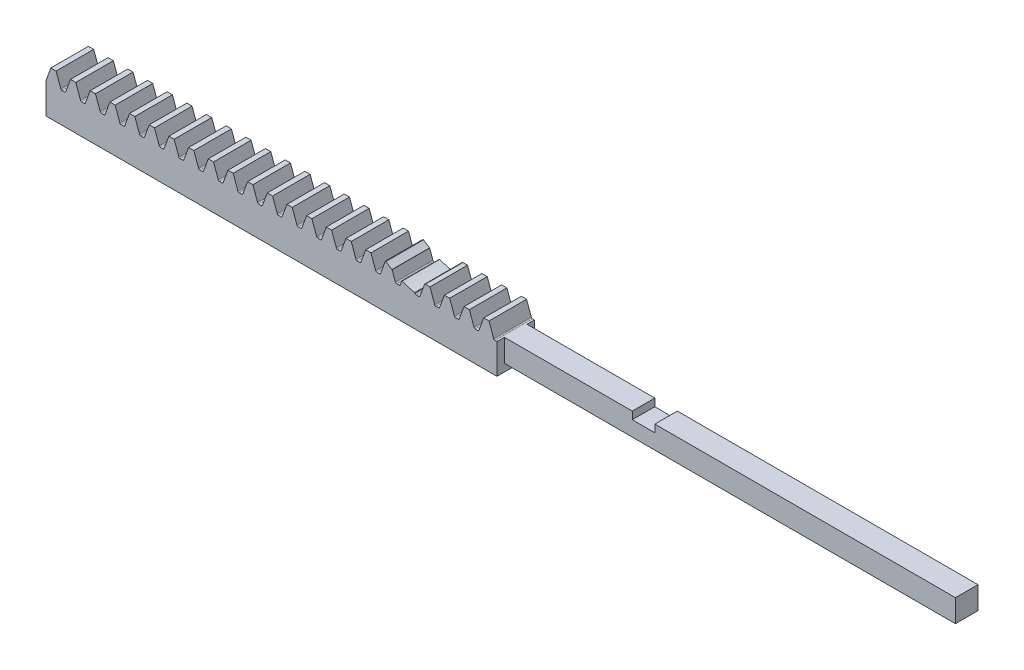
from build123d import *

# Parameters (mm, degrees)
SKETCH1_W                       = 609.6
SKETCH1_H                       = 25.4
BOSS_EXTRUDE1_DEPTH             = 12.7
CUT_EXTRUDE1_DEPTH              = 25.4
FILLET3_R                       = 0.43167355
LPATTERN4_START                 = -12.7
LPATTERN4_DEPTH                 = 25.4
SKETCH5_W                       = 609.6
SKETCH5_H                       = 25.4
CUT_EXTRUDE2_DEPTH              = 10.532533418
SKETCH6_W                       = 609.6
SKETCH6_H                       = 15.910853878
CUT_EXTRUDE3_DEPTH              = 12.7
SKETCH7_W                       = 12.7
SKETCH7_H                       = 14.867466582
CUT_EXTRUDE4_DEPTH              = 457.2
F_1_4_0_25_DIAMETER_HOLE1_D     = 6.35
F_1_4_0_25_DIAMETER_HOLE1_DEPTH = 12.7
F_1_4_0_25_DIAMETER_HOLE1_TIP   = 1.907732465
SKETCH20_W                      = 7.62
SKETCH20_H                      = 7.62
BOSS_EXTRUDE2_DEPTH             = 152.4
CUT_EXTRUDE6_DEPTH              = 12.7
CHAMFER1_SIZE                   = 0.127
CHAMFER1_SIZE2                  = 0.212490963
FILLET4_R                       = 0.127
SKETCH25_W                      = 7.62
SKETCH25_H                      = 7.62
CUT_EXTRUDE7_DEPTH              = 2.54


# Read off the part's stored shape, not the designer's step: LPattern4
with BuildPart() as part:
    # Sketch1 → Boss-Extrude1 (new, symmetric)
    with BuildSketch(Plane.XY):
        Rectangle(SKETCH1_W, SKETCH1_H)
    extrude(amount=BOSS_EXTRUDE1_DEPTH, both=True)

    # Sketch2 → Cut-Extrude1 (cut)
    with BuildSketch(Plane.XY.offset(12.7)):
        Polygon((-303.015947325, 12.7), (-301.30256958, 7.992533333), (-299.863657745, 7.992533333), (-298.15028, 12.7), align=None)
    extrude(amount=-CUT_EXTRUDE1_DEPTH, mode=Mode.SUBTRACT)

    # Fillet3
    fillet3_edges = [part.edges().sort_by_distance(p)[0] for p in [
        (-299.863657745, 7.992533333, 0),
        (-301.30256958, 7.992533333, 0),
    ]]
    fillet(fillet3_edges, radius=FILLET3_R)

    # LPattern4 outline → LPattern4 (cut)
    with BuildSketch(Plane.XY.offset(LPATTERN4_START)):
        with BuildLine():
            ThreePointArc((-294.756228955, 8.276565834), (-294.598186282, 8.070600612), (-294.350588506, 7.992533333))
            Line((-294.350588506, 7.992533333), (-293.516198819, 7.992533333))
            ThreePointArc((-293.516198819, 7.992533333), (-293.268601043, 8.070600612), (-293.11055837, 8.276565834))
            Line((-293.11055837, 8.276565834), (-291.50056, 12.7))
            Line((-291.50056, 12.7), (-296.366227325, 12.7))
            Line((-296.366227325, 12.7), (-294.756228955, 8.276565834))
        make_face()
        with BuildLine():
            Line((304.8, 12.7), (302.108572675, 12.7))
            Line((302.108572675, 12.7), (303.718571045, 8.276565834))
            ThreePointArc((303.718571045, 8.276565834), (303.876613718, 8.070600612), (304.124211494, 7.992533333))
            Line((304.124211494, 7.992533333), (304.8, 7.992533333))
            Line((304.8, 7.992533333), (304.8, 12.7))
        make_face()
        with BuildLine():
            Line((300.32452, 12.7), (295.458852675, 12.7))
            Line((295.458852675, 12.7), (297.068851045, 8.276565834))
            ThreePointArc((297.068851045, 8.276565834), (297.226893718, 8.070600612), (297.474491494, 7.992533333))
            Line((297.474491494, 7.992533333), (298.308881181, 7.992533333))
            ThreePointArc((298.308881181, 7.992533333), (298.556478957, 8.070600612), (298.71452163, 8.276565834))
            Line((298.71452163, 8.276565834), (300.32452, 12.7))
        make_face()
        with BuildLine():
            Line((293.6748, 12.7), (288.809132675, 12.7))
            Line((288.809132675, 12.7), (290.419131045, 8.276565834))
            ThreePointArc((290.419131045, 8.276565834), (290.577173718, 8.070600612), (290.824771494, 7.992533333))
            Line((290.824771494, 7.992533333), (291.659161181, 7.992533333))
            ThreePointArc((291.659161181, 7.992533333), (291.906758957, 8.070600612), (292.06480163, 8.276565834))
            Line((292.06480163, 8.276565834), (293.6748, 12.7))
        make_face()
        with BuildLine():
            Line((287.02508, 12.7), (282.159412675, 12.7))
            Line((282.159412675, 12.7), (283.769411045, 8.276565834))
            ThreePointArc((283.769411045, 8.276565834), (283.927453718, 8.070600612), (284.175051494, 7.992533333))
            Line((284.175051494, 7.992533333), (285.009441181, 7.992533333))
            ThreePointArc((285.009441181, 7.992533333), (285.257038957, 8.070600612), (285.41508163, 8.276565834))
            Line((285.41508163, 8.276565834), (287.02508, 12.7))
        make_face()
        with BuildLine():
            Line((280.37536, 12.7), (275.509692675, 12.7))
            Line((275.509692675, 12.7), (277.119691045, 8.276565834))
            ThreePointArc((277.119691045, 8.276565834), (277.277733718, 8.070600612), (277.525331494, 7.992533333))
            Line((277.525331494, 7.992533333), (278.359721181, 7.992533333))
            ThreePointArc((278.359721181, 7.992533333), (278.607318957, 8.070600612), (278.76536163, 8.276565834))
            Line((278.76536163, 8.276565834), (280.37536, 12.7))
        make_face()
        with BuildLine():
            Line((273.72564, 12.7), (268.859972675, 12.7))
            Line((268.859972675, 12.7), (270.469971045, 8.276565834))
            ThreePointArc((270.469971045, 8.276565834), (270.628013718, 8.070600612), (270.875611494, 7.992533333))
            Line((270.875611494, 7.992533333), (271.710001181, 7.992533333))
            ThreePointArc((271.710001181, 7.992533333), (271.957598957, 8.070600612), (272.11564163, 8.276565834))
            Line((272.11564163, 8.276565834), (273.72564, 12.7))
        make_face()
        with BuildLine():
            Line((267.07592, 12.7), (262.210252675, 12.7))
            Line((262.210252675, 12.7), (263.820251045, 8.276565834))
            ThreePointArc((263.820251045, 8.276565834), (263.978293718, 8.070600612), (264.225891494, 7.992533333))
            Line((264.225891494, 7.992533333), (265.060281181, 7.992533333))
            ThreePointArc((265.060281181, 7.992533333), (265.307878957, 8.070600612), (265.46592163, 8.276565834))
            Line((265.46592163, 8.276565834), (267.07592, 12.7))
        make_face()
        with BuildLine():
            Line((260.4262, 12.7), (255.560532675, 12.7))
            Line((255.560532675, 12.7), (257.170531045, 8.276565834))
            ThreePointArc((257.170531045, 8.276565834), (257.328573718, 8.070600612), (257.576171494, 7.992533333))
            Line((257.576171494, 7.992533333), (258.410561181, 7.992533333))
            ThreePointArc((258.410561181, 7.992533333), (258.658158957, 8.070600612), (258.81620163, 8.276565834))
            Line((258.81620163, 8.276565834), (260.4262, 12.7))
        make_face()
        with BuildLine():
            Line((253.77648, 12.7), (248.910812675, 12.7))
            Line((248.910812675, 12.7), (250.520811045, 8.276565834))
            ThreePointArc((250.520811045, 8.276565834), (250.678853718, 8.070600612), (250.926451494, 7.992533333))
            Line((250.926451494, 7.992533333), (251.760841181, 7.992533333))
            ThreePointArc((251.760841181, 7.992533333), (252.008438957, 8.070600612), (252.16648163, 8.276565834))
            Line((252.16648163, 8.276565834), (253.77648, 12.7))
        make_face()
        with BuildLine():
            Line((247.12676, 12.7), (242.261092675, 12.7))
            Line((242.261092675, 12.7), (243.871091045, 8.276565834))
            ThreePointArc((243.871091045, 8.276565834), (244.029133718, 8.070600612), (244.276731494, 7.992533333))
            Line((244.276731494, 7.992533333), (245.111121181, 7.992533333))
            ThreePointArc((245.111121181, 7.992533333), (245.358718957, 8.070600612), (245.51676163, 8.276565834))
            Line((245.51676163, 8.276565834), (247.12676, 12.7))
        make_face()
        with BuildLine():
            Line((240.47704, 12.7), (235.611372675, 12.7))
            Line((235.611372675, 12.7), (237.221371045, 8.276565834))
            ThreePointArc((237.221371045, 8.276565834), (237.379413718, 8.070600612), (237.627011494, 7.992533333))
            Line((237.627011494, 7.992533333), (238.461401181, 7.992533333))
            ThreePointArc((238.461401181, 7.992533333), (238.708998957, 8.070600612), (238.86704163, 8.276565834))
            Line((238.86704163, 8.276565834), (240.47704, 12.7))
        make_face()
        with BuildLine():
            Line((233.82732, 12.7), (228.961652675, 12.7))
            Line((228.961652675, 12.7), (230.571651045, 8.276565834))
            ThreePointArc((230.571651045, 8.276565834), (230.729693718, 8.070600612), (230.977291494, 7.992533333))
            Line((230.977291494, 7.992533333), (231.811681181, 7.992533333))
            ThreePointArc((231.811681181, 7.992533333), (232.059278957, 8.070600612), (232.21732163, 8.276565834))
            Line((232.21732163, 8.276565834), (233.82732, 12.7))
        make_face()
        with BuildLine():
            Line((227.1776, 12.7), (222.311932675, 12.7))
            Line((222.311932675, 12.7), (223.921931045, 8.276565834))
            ThreePointArc((223.921931045, 8.276565834), (224.079973718, 8.070600612), (224.327571494, 7.992533333))
            Line((224.327571494, 7.992533333), (225.161961181, 7.992533333))
            ThreePointArc((225.161961181, 7.992533333), (225.409558957, 8.070600612), (225.56760163, 8.276565834))
            Line((225.56760163, 8.276565834), (227.1776, 12.7))
        make_face()
        with BuildLine():
            Line((220.52788, 12.7), (215.662212675, 12.7))
            Line((215.662212675, 12.7), (217.272211045, 8.276565834))
            ThreePointArc((217.272211045, 8.276565834), (217.430253718, 8.070600612), (217.677851494, 7.992533333))
            Line((217.677851494, 7.992533333), (218.512241181, 7.992533333))
            ThreePointArc((218.512241181, 7.992533333), (218.759838957, 8.070600612), (218.91788163, 8.276565834))
            Line((218.91788163, 8.276565834), (220.52788, 12.7))
        make_face()
        with BuildLine():
            Line((213.87816, 12.7), (209.012492675, 12.7))
            Line((209.012492675, 12.7), (210.622491045, 8.276565834))
            ThreePointArc((210.622491045, 8.276565834), (210.780533718, 8.070600612), (211.028131494, 7.992533333))
            Line((211.028131494, 7.992533333), (211.862521181, 7.992533333))
            ThreePointArc((211.862521181, 7.992533333), (212.110118957, 8.070600612), (212.26816163, 8.276565834))
            Line((212.26816163, 8.276565834), (213.87816, 12.7))
        make_face()
        with BuildLine():
            Line((207.22844, 12.7), (202.362772675, 12.7))
            Line((202.362772675, 12.7), (203.972771045, 8.276565834))
            ThreePointArc((203.972771045, 8.276565834), (204.130813718, 8.070600612), (204.378411494, 7.992533333))
            Line((204.378411494, 7.992533333), (205.212801181, 7.992533333))
            ThreePointArc((205.212801181, 7.992533333), (205.460398957, 8.070600612), (205.61844163, 8.276565834))
            Line((205.61844163, 8.276565834), (207.22844, 12.7))
        make_face()
        with BuildLine():
            Line((200.57872, 12.7), (195.713052675, 12.7))
            Line((195.713052675, 12.7), (197.323051045, 8.276565834))
            ThreePointArc((197.323051045, 8.276565834), (197.481093718, 8.070600612), (197.728691494, 7.992533333))
            Line((197.728691494, 7.992533333), (198.563081181, 7.992533333))
            ThreePointArc((198.563081181, 7.992533333), (198.810678957, 8.070600612), (198.96872163, 8.276565834))
            Line((198.96872163, 8.276565834), (200.57872, 12.7))
        make_face()
        with BuildLine():
            Line((193.929, 12.7), (189.063332675, 12.7))
            Line((189.063332675, 12.7), (190.673331045, 8.276565834))
            ThreePointArc((190.673331045, 8.276565834), (190.831373718, 8.070600612), (191.078971494, 7.992533333))
            Line((191.078971494, 7.992533333), (191.913361181, 7.992533333))
            ThreePointArc((191.913361181, 7.992533333), (192.160958957, 8.070600612), (192.31900163, 8.276565834))
            Line((192.31900163, 8.276565834), (193.929, 12.7))
        make_face()
        with BuildLine():
            Line((187.27928, 12.7), (182.413612675, 12.7))
            Line((182.413612675, 12.7), (184.023611045, 8.276565834))
            ThreePointArc((184.023611045, 8.276565834), (184.181653718, 8.070600612), (184.429251494, 7.992533333))
            Line((184.429251494, 7.992533333), (185.263641181, 7.992533333))
            ThreePointArc((185.263641181, 7.992533333), (185.511238957, 8.070600612), (185.66928163, 8.276565834))
            Line((185.66928163, 8.276565834), (187.27928, 12.7))
        make_face()
        with BuildLine():
            Line((180.62956, 12.7), (175.763892675, 12.7))
            Line((175.763892675, 12.7), (177.373891045, 8.276565834))
            ThreePointArc((177.373891045, 8.276565834), (177.531933718, 8.070600612), (177.779531494, 7.992533333))
            Line((177.779531494, 7.992533333), (178.613921181, 7.992533333))
            ThreePointArc((178.613921181, 7.992533333), (178.861518957, 8.070600612), (179.01956163, 8.276565834))
            Line((179.01956163, 8.276565834), (180.62956, 12.7))
        make_face()
        with BuildLine():
            Line((173.97984, 12.7), (169.114172675, 12.7))
            Line((169.114172675, 12.7), (170.724171045, 8.276565834))
            ThreePointArc((170.724171045, 8.276565834), (170.882213718, 8.070600612), (171.129811494, 7.992533333))
            Line((171.129811494, 7.992533333), (171.964201181, 7.992533333))
            ThreePointArc((171.964201181, 7.992533333), (172.211798957, 8.070600612), (172.36984163, 8.276565834))
            Line((172.36984163, 8.276565834), (173.97984, 12.7))
        make_face()
        with BuildLine():
            Line((167.33012, 12.7), (162.464452675, 12.7))
            Line((162.464452675, 12.7), (164.074451045, 8.276565834))
            ThreePointArc((164.074451045, 8.276565834), (164.232493718, 8.070600612), (164.480091494, 7.992533333))
            Line((164.480091494, 7.992533333), (165.314481181, 7.992533333))
            ThreePointArc((165.314481181, 7.992533333), (165.562078957, 8.070600612), (165.72012163, 8.276565834))
            Line((165.72012163, 8.276565834), (167.33012, 12.7))
        make_face()
        with BuildLine():
            Line((160.6804, 12.7), (155.814732675, 12.7))
            Line((155.814732675, 12.7), (157.424731045, 8.276565834))
            ThreePointArc((157.424731045, 8.276565834), (157.582773718, 8.070600612), (157.830371494, 7.992533333))
            Line((157.830371494, 7.992533333), (158.664761181, 7.992533333))
            ThreePointArc((158.664761181, 7.992533333), (158.912358957, 8.070600612), (159.07040163, 8.276565834))
            Line((159.07040163, 8.276565834), (160.6804, 12.7))
        make_face()
        with BuildLine():
            Line((154.03068, 12.7), (149.165012675, 12.7))
            Line((149.165012675, 12.7), (150.775011045, 8.276565834))
            ThreePointArc((150.775011045, 8.276565834), (150.933053718, 8.070600612), (151.180651494, 7.992533333))
            Line((151.180651494, 7.992533333), (152.015041181, 7.992533333))
            ThreePointArc((152.015041181, 7.992533333), (152.262638957, 8.070600612), (152.42068163, 8.276565834))
            Line((152.42068163, 8.276565834), (154.03068, 12.7))
        make_face()
        with BuildLine():
            Line((147.38096, 12.7), (142.515292675, 12.7))
            Line((142.515292675, 12.7), (144.125291045, 8.276565834))
            ThreePointArc((144.125291045, 8.276565834), (144.283333718, 8.070600612), (144.530931494, 7.992533333))
            Line((144.530931494, 7.992533333), (145.365321181, 7.992533333))
            ThreePointArc((145.365321181, 7.992533333), (145.612918957, 8.070600612), (145.77096163, 8.276565834))
            Line((145.77096163, 8.276565834), (147.38096, 12.7))
        make_face()
        with BuildLine():
            Line((140.73124, 12.7), (135.865572675, 12.7))
            Line((135.865572675, 12.7), (137.475571045, 8.276565834))
            ThreePointArc((137.475571045, 8.276565834), (137.633613718, 8.070600612), (137.881211494, 7.992533333))
            Line((137.881211494, 7.992533333), (138.715601181, 7.992533333))
            ThreePointArc((138.715601181, 7.992533333), (138.963198957, 8.070600612), (139.12124163, 8.276565834))
            Line((139.12124163, 8.276565834), (140.73124, 12.7))
        make_face()
        with BuildLine():
            Line((134.08152, 12.7), (129.215852675, 12.7))
            Line((129.215852675, 12.7), (130.825851045, 8.276565834))
            ThreePointArc((130.825851045, 8.276565834), (130.983893718, 8.070600612), (131.231491494, 7.992533333))
            Line((131.231491494, 7.992533333), (132.065881181, 7.992533333))
            ThreePointArc((132.065881181, 7.992533333), (132.313478957, 8.070600612), (132.47152163, 8.276565834))
            Line((132.47152163, 8.276565834), (134.08152, 12.7))
        make_face()
        with BuildLine():
            Line((127.4318, 12.7), (122.566132675, 12.7))
            Line((122.566132675, 12.7), (124.176131045, 8.276565834))
            ThreePointArc((124.176131045, 8.276565834), (124.334173718, 8.070600612), (124.581771494, 7.992533333))
            Line((124.581771494, 7.992533333), (125.416161181, 7.992533333))
            ThreePointArc((125.416161181, 7.992533333), (125.663758957, 8.070600612), (125.82180163, 8.276565834))
            Line((125.82180163, 8.276565834), (127.4318, 12.7))
        make_face()
        with BuildLine():
            Line((120.78208, 12.7), (115.916412675, 12.7))
            Line((115.916412675, 12.7), (117.526411045, 8.276565834))
            ThreePointArc((117.526411045, 8.276565834), (117.684453718, 8.070600612), (117.932051494, 7.992533333))
            Line((117.932051494, 7.992533333), (118.766441181, 7.992533333))
            ThreePointArc((118.766441181, 7.992533333), (119.014038957, 8.070600612), (119.17208163, 8.276565834))
            Line((119.17208163, 8.276565834), (120.78208, 12.7))
        make_face()
        with BuildLine():
            Line((114.13236, 12.7), (109.266692675, 12.7))
            Line((109.266692675, 12.7), (110.876691045, 8.276565834))
            ThreePointArc((110.876691045, 8.276565834), (111.034733718, 8.070600612), (111.282331494, 7.992533333))
            Line((111.282331494, 7.992533333), (112.116721181, 7.992533333))
            ThreePointArc((112.116721181, 7.992533333), (112.364318957, 8.070600612), (112.52236163, 8.276565834))
            Line((112.52236163, 8.276565834), (114.13236, 12.7))
        make_face()
        with BuildLine():
            Line((107.48264, 12.7), (102.616972675, 12.7))
            Line((102.616972675, 12.7), (104.226971045, 8.276565834))
            ThreePointArc((104.226971045, 8.276565834), (104.385013718, 8.070600612), (104.632611494, 7.992533333))
            Line((104.632611494, 7.992533333), (105.467001181, 7.992533333))
            ThreePointArc((105.467001181, 7.992533333), (105.714598957, 8.070600612), (105.87264163, 8.276565834))
            Line((105.87264163, 8.276565834), (107.48264, 12.7))
        make_face()
        with BuildLine():
            Line((100.83292, 12.7), (95.967252675, 12.7))
            Line((95.967252675, 12.7), (97.577251045, 8.276565834))
            ThreePointArc((97.577251045, 8.276565834), (97.735293718, 8.070600612), (97.982891494, 7.992533333))
            Line((97.982891494, 7.992533333), (98.817281181, 7.992533333))
            ThreePointArc((98.817281181, 7.992533333), (99.064878957, 8.070600612), (99.22292163, 8.276565834))
            Line((99.22292163, 8.276565834), (100.83292, 12.7))
        make_face()
        with BuildLine():
            Line((94.1832, 12.7), (89.317532675, 12.7))
            Line((89.317532675, 12.7), (90.927531045, 8.276565834))
            ThreePointArc((90.927531045, 8.276565834), (91.085573718, 8.070600612), (91.333171494, 7.992533333))
            Line((91.333171494, 7.992533333), (92.167561181, 7.992533333))
            ThreePointArc((92.167561181, 7.992533333), (92.415158957, 8.070600612), (92.57320163, 8.276565834))
            Line((92.57320163, 8.276565834), (94.1832, 12.7))
        make_face()
        with BuildLine():
            Line((87.53348, 12.7), (82.667812675, 12.7))
            Line((82.667812675, 12.7), (84.277811045, 8.276565834))
            ThreePointArc((84.277811045, 8.276565834), (84.435853718, 8.070600612), (84.683451494, 7.992533333))
            Line((84.683451494, 7.992533333), (85.517841181, 7.992533333))
            ThreePointArc((85.517841181, 7.992533333), (85.765438957, 8.070600612), (85.92348163, 8.276565834))
            Line((85.92348163, 8.276565834), (87.53348, 12.7))
        make_face()
        with BuildLine():
            Line((80.88376, 12.7), (76.018092675, 12.7))
            Line((76.018092675, 12.7), (77.628091045, 8.276565834))
            ThreePointArc((77.628091045, 8.276565834), (77.786133718, 8.070600612), (78.033731494, 7.992533333))
            Line((78.033731494, 7.992533333), (78.868121181, 7.992533333))
            ThreePointArc((78.868121181, 7.992533333), (79.115718957, 8.070600612), (79.27376163, 8.276565834))
            Line((79.27376163, 8.276565834), (80.88376, 12.7))
        make_face()
        with BuildLine():
            Line((74.23404, 12.7), (69.368372675, 12.7))
            Line((69.368372675, 12.7), (70.978371045, 8.276565834))
            ThreePointArc((70.978371045, 8.276565834), (71.136413718, 8.070600612), (71.384011494, 7.992533333))
            Line((71.384011494, 7.992533333), (72.218401181, 7.992533333))
            ThreePointArc((72.218401181, 7.992533333), (72.465998957, 8.070600612), (72.62404163, 8.276565834))
            Line((72.62404163, 8.276565834), (74.23404, 12.7))
        make_face()
        with BuildLine():
            Line((67.58432, 12.7), (62.718652675, 12.7))
            Line((62.718652675, 12.7), (64.328651045, 8.276565834))
            ThreePointArc((64.328651045, 8.276565834), (64.486693718, 8.070600612), (64.734291494, 7.992533333))
            Line((64.734291494, 7.992533333), (65.568681181, 7.992533333))
            ThreePointArc((65.568681181, 7.992533333), (65.816278957, 8.070600612), (65.97432163, 8.276565834))
            Line((65.97432163, 8.276565834), (67.58432, 12.7))
        make_face()
        with BuildLine():
            Line((60.9346, 12.7), (56.068932675, 12.7))
            Line((56.068932675, 12.7), (57.678931045, 8.276565834))
            ThreePointArc((57.678931045, 8.276565834), (57.836973718, 8.070600612), (58.084571494, 7.992533333))
            Line((58.084571494, 7.992533333), (58.918961181, 7.992533333))
            ThreePointArc((58.918961181, 7.992533333), (59.166558957, 8.070600612), (59.32460163, 8.276565834))
            Line((59.32460163, 8.276565834), (60.9346, 12.7))
        make_face()
        with BuildLine():
            Line((54.28488, 12.7), (49.419212675, 12.7))
            Line((49.419212675, 12.7), (51.029211045, 8.276565834))
            ThreePointArc((51.029211045, 8.276565834), (51.187253718, 8.070600612), (51.434851494, 7.992533333))
            Line((51.434851494, 7.992533333), (52.269241181, 7.992533333))
            ThreePointArc((52.269241181, 7.992533333), (52.516838957, 8.070600612), (52.67488163, 8.276565834))
            Line((52.67488163, 8.276565834), (54.28488, 12.7))
        make_face()
        with BuildLine():
            Line((47.63516, 12.7), (42.769492675, 12.7))
            Line((42.769492675, 12.7), (44.379491045, 8.276565834))
            ThreePointArc((44.379491045, 8.276565834), (44.537533718, 8.070600612), (44.785131494, 7.992533333))
            Line((44.785131494, 7.992533333), (45.619521181, 7.992533333))
            ThreePointArc((45.619521181, 7.992533333), (45.867118957, 8.070600612), (46.02516163, 8.276565834))
            Line((46.02516163, 8.276565834), (47.63516, 12.7))
        make_face()
        with BuildLine():
            Line((40.98544, 12.7), (36.119772675, 12.7))
            Line((36.119772675, 12.7), (37.729771045, 8.276565834))
            ThreePointArc((37.729771045, 8.276565834), (37.887813718, 8.070600612), (38.135411494, 7.992533333))
            Line((38.135411494, 7.992533333), (38.969801181, 7.992533333))
            ThreePointArc((38.969801181, 7.992533333), (39.217398957, 8.070600612), (39.37544163, 8.276565834))
            Line((39.37544163, 8.276565834), (40.98544, 12.7))
        make_face()
        with BuildLine():
            Line((34.33572, 12.7), (29.470052675, 12.7))
            Line((29.470052675, 12.7), (31.080051045, 8.276565834))
            ThreePointArc((31.080051045, 8.276565834), (31.238093718, 8.070600612), (31.485691494, 7.992533333))
            Line((31.485691494, 7.992533333), (32.320081181, 7.992533333))
            ThreePointArc((32.320081181, 7.992533333), (32.567678957, 8.070600612), (32.72572163, 8.276565834))
            Line((32.72572163, 8.276565834), (34.33572, 12.7))
        make_face()
        with BuildLine():
            Line((27.686, 12.7), (22.820332675, 12.7))
            Line((22.820332675, 12.7), (24.430331045, 8.276565834))
            ThreePointArc((24.430331045, 8.276565834), (24.588373718, 8.070600612), (24.835971494, 7.992533333))
            Line((24.835971494, 7.992533333), (25.670361181, 7.992533333))
            ThreePointArc((25.670361181, 7.992533333), (25.917958957, 8.070600612), (26.07600163, 8.276565834))
            Line((26.07600163, 8.276565834), (27.686, 12.7))
        make_face()
        with BuildLine():
            Line((21.03628, 12.7), (16.170612675, 12.7))
            Line((16.170612675, 12.7), (17.780611045, 8.276565834))
            ThreePointArc((17.780611045, 8.276565834), (17.938653718, 8.070600612), (18.186251494, 7.992533333))
            Line((18.186251494, 7.992533333), (19.020641181, 7.992533333))
            ThreePointArc((19.020641181, 7.992533333), (19.268238957, 8.070600612), (19.42628163, 8.276565834))
            Line((19.42628163, 8.276565834), (21.03628, 12.7))
        make_face()
        with BuildLine():
            Line((14.38656, 12.7), (9.520892675, 12.7))
            Line((9.520892675, 12.7), (11.130891045, 8.276565834))
            ThreePointArc((11.130891045, 8.276565834), (11.288933718, 8.070600612), (11.536531494, 7.992533333))
            Line((11.536531494, 7.992533333), (12.370921181, 7.992533333))
            ThreePointArc((12.370921181, 7.992533333), (12.618518957, 8.070600612), (12.77656163, 8.276565834))
            Line((12.77656163, 8.276565834), (14.38656, 12.7))
        make_face()
        with BuildLine():
            Line((7.73684, 12.7), (2.871172675, 12.7))
            Line((2.871172675, 12.7), (4.481171045, 8.276565834))
            ThreePointArc((4.481171045, 8.276565834), (4.639213718, 8.070600612), (4.886811494, 7.992533333))
            Line((4.886811494, 7.992533333), (5.721201181, 7.992533333))
            ThreePointArc((5.721201181, 7.992533333), (5.968798957, 8.070600612), (6.12684163, 8.276565834))
            Line((6.12684163, 8.276565834), (7.73684, 12.7))
        make_face()
        with BuildLine():
            Line((1.08712, 12.7), (-3.778547325, 12.7))
            Line((-3.778547325, 12.7), (-2.168548955, 8.276565834))
            ThreePointArc((-2.168548955, 8.276565834), (-2.010506282, 8.070600612), (-1.762908506, 7.992533333))
            Line((-1.762908506, 7.992533333), (-0.928518819, 7.992533333))
            ThreePointArc((-0.928518819, 7.992533333), (-0.680921043, 8.070600612), (-0.52287837, 8.276565834))
            Line((-0.52287837, 8.276565834), (1.08712, 12.7))
        make_face()
        with BuildLine():
            Line((-5.5626, 12.7), (-10.428267325, 12.7))
            Line((-10.428267325, 12.7), (-8.818268955, 8.276565834))
            ThreePointArc((-8.818268955, 8.276565834), (-8.660226282, 8.070600612), (-8.412628506, 7.992533333))
            Line((-8.412628506, 7.992533333), (-7.578238819, 7.992533333))
            ThreePointArc((-7.578238819, 7.992533333), (-7.330641043, 8.070600612), (-7.17259837, 8.276565834))
            Line((-7.17259837, 8.276565834), (-5.5626, 12.7))
        make_face()
        with BuildLine():
            Line((-12.21232, 12.7), (-17.077987325, 12.7))
            Line((-17.077987325, 12.7), (-15.467988955, 8.276565834))
            ThreePointArc((-15.467988955, 8.276565834), (-15.309946282, 8.070600612), (-15.062348506, 7.992533333))
            Line((-15.062348506, 7.992533333), (-14.227958819, 7.992533333))
            ThreePointArc((-14.227958819, 7.992533333), (-13.980361043, 8.070600612), (-13.82231837, 8.276565834))
            Line((-13.82231837, 8.276565834), (-12.21232, 12.7))
        make_face()
        with BuildLine():
            Line((-18.86204, 12.7), (-23.727707325, 12.7))
            Line((-23.727707325, 12.7), (-22.117708955, 8.276565834))
            ThreePointArc((-22.117708955, 8.276565834), (-21.959666282, 8.070600612), (-21.712068506, 7.992533333))
            Line((-21.712068506, 7.992533333), (-20.877678819, 7.992533333))
            ThreePointArc((-20.877678819, 7.992533333), (-20.630081043, 8.070600612), (-20.47203837, 8.276565834))
            Line((-20.47203837, 8.276565834), (-18.86204, 12.7))
        make_face()
        with BuildLine():
            Line((-25.51176, 12.7), (-30.377427325, 12.7))
            Line((-30.377427325, 12.7), (-28.767428955, 8.276565834))
            ThreePointArc((-28.767428955, 8.276565834), (-28.609386282, 8.070600612), (-28.361788506, 7.992533333))
            Line((-28.361788506, 7.992533333), (-27.527398819, 7.992533333))
            ThreePointArc((-27.527398819, 7.992533333), (-27.279801043, 8.070600612), (-27.12175837, 8.276565834))
            Line((-27.12175837, 8.276565834), (-25.51176, 12.7))
        make_face()
        with BuildLine():
            Line((-32.16148, 12.7), (-37.027147325, 12.7))
            Line((-37.027147325, 12.7), (-35.417148955, 8.276565834))
            ThreePointArc((-35.417148955, 8.276565834), (-35.259106282, 8.070600612), (-35.011508506, 7.992533333))
            Line((-35.011508506, 7.992533333), (-34.177118819, 7.992533333))
            ThreePointArc((-34.177118819, 7.992533333), (-33.929521043, 8.070600612), (-33.77147837, 8.276565834))
            Line((-33.77147837, 8.276565834), (-32.16148, 12.7))
        make_face()
        with BuildLine():
            Line((-38.8112, 12.7), (-43.676867325, 12.7))
            Line((-43.676867325, 12.7), (-42.066868955, 8.276565834))
            ThreePointArc((-42.066868955, 8.276565834), (-41.908826282, 8.070600612), (-41.661228506, 7.992533333))
            Line((-41.661228506, 7.992533333), (-40.826838819, 7.992533333))
            ThreePointArc((-40.826838819, 7.992533333), (-40.579241043, 8.070600612), (-40.42119837, 8.276565834))
            Line((-40.42119837, 8.276565834), (-38.8112, 12.7))
        make_face()
        with BuildLine():
            Line((-45.46092, 12.7), (-50.326587325, 12.7))
            Line((-50.326587325, 12.7), (-48.716588955, 8.276565834))
            ThreePointArc((-48.716588955, 8.276565834), (-48.558546282, 8.070600612), (-48.310948506, 7.992533333))
            Line((-48.310948506, 7.992533333), (-47.476558819, 7.992533333))
            ThreePointArc((-47.476558819, 7.992533333), (-47.228961043, 8.070600612), (-47.07091837, 8.276565834))
            Line((-47.07091837, 8.276565834), (-45.46092, 12.7))
        make_face()
        with BuildLine():
            Line((-52.11064, 12.7), (-56.976307325, 12.7))
            Line((-56.976307325, 12.7), (-55.366308955, 8.276565834))
            ThreePointArc((-55.366308955, 8.276565834), (-55.208266282, 8.070600612), (-54.960668506, 7.992533333))
            Line((-54.960668506, 7.992533333), (-54.126278819, 7.992533333))
            ThreePointArc((-54.126278819, 7.992533333), (-53.878681043, 8.070600612), (-53.72063837, 8.276565834))
            Line((-53.72063837, 8.276565834), (-52.11064, 12.7))
        make_face()
        with BuildLine():
            Line((-58.76036, 12.7), (-63.626027325, 12.7))
            Line((-63.626027325, 12.7), (-62.016028955, 8.276565834))
            ThreePointArc((-62.016028955, 8.276565834), (-61.857986282, 8.070600612), (-61.610388506, 7.992533333))
            Line((-61.610388506, 7.992533333), (-60.775998819, 7.992533333))
            ThreePointArc((-60.775998819, 7.992533333), (-60.528401043, 8.070600612), (-60.37035837, 8.276565834))
            Line((-60.37035837, 8.276565834), (-58.76036, 12.7))
        make_face()
        with BuildLine():
            Line((-65.41008, 12.7), (-70.275747325, 12.7))
            Line((-70.275747325, 12.7), (-68.665748955, 8.276565834))
            ThreePointArc((-68.665748955, 8.276565834), (-68.507706282, 8.070600612), (-68.260108506, 7.992533333))
            Line((-68.260108506, 7.992533333), (-67.425718819, 7.992533333))
            ThreePointArc((-67.425718819, 7.992533333), (-67.178121043, 8.070600612), (-67.02007837, 8.276565834))
            Line((-67.02007837, 8.276565834), (-65.41008, 12.7))
        make_face()
        with BuildLine():
            Line((-72.0598, 12.7), (-76.925467325, 12.7))
            Line((-76.925467325, 12.7), (-75.315468955, 8.276565834))
            ThreePointArc((-75.315468955, 8.276565834), (-75.157426282, 8.070600612), (-74.909828506, 7.992533333))
            Line((-74.909828506, 7.992533333), (-74.075438819, 7.992533333))
            ThreePointArc((-74.075438819, 7.992533333), (-73.827841043, 8.070600612), (-73.66979837, 8.276565834))
            Line((-73.66979837, 8.276565834), (-72.0598, 12.7))
        make_face()
        with BuildLine():
            Line((-78.70952, 12.7), (-83.575187325, 12.7))
            Line((-83.575187325, 12.7), (-81.965188955, 8.276565834))
            ThreePointArc((-81.965188955, 8.276565834), (-81.807146282, 8.070600612), (-81.559548506, 7.992533333))
            Line((-81.559548506, 7.992533333), (-80.725158819, 7.992533333))
            ThreePointArc((-80.725158819, 7.992533333), (-80.477561043, 8.070600612), (-80.31951837, 8.276565834))
            Line((-80.31951837, 8.276565834), (-78.70952, 12.7))
        make_face()
        with BuildLine():
            Line((-85.35924, 12.7), (-90.224907325, 12.7))
            Line((-90.224907325, 12.7), (-88.614908955, 8.276565834))
            ThreePointArc((-88.614908955, 8.276565834), (-88.456866282, 8.070600612), (-88.209268506, 7.992533333))
            Line((-88.209268506, 7.992533333), (-87.374878819, 7.992533333))
            ThreePointArc((-87.374878819, 7.992533333), (-87.127281043, 8.070600612), (-86.96923837, 8.276565834))
            Line((-86.96923837, 8.276565834), (-85.35924, 12.7))
        make_face()
        with BuildLine():
            Line((-92.00896, 12.7), (-96.874627325, 12.7))
            Line((-96.874627325, 12.7), (-95.264628955, 8.276565834))
            ThreePointArc((-95.264628955, 8.276565834), (-95.106586282, 8.070600612), (-94.858988506, 7.992533333))
            Line((-94.858988506, 7.992533333), (-94.024598819, 7.992533333))
            ThreePointArc((-94.024598819, 7.992533333), (-93.777001043, 8.070600612), (-93.61895837, 8.276565834))
            Line((-93.61895837, 8.276565834), (-92.00896, 12.7))
        make_face()
        with BuildLine():
            Line((-98.65868, 12.7), (-103.524347325, 12.7))
            Line((-103.524347325, 12.7), (-101.914348955, 8.276565834))
            ThreePointArc((-101.914348955, 8.276565834), (-101.756306282, 8.070600612), (-101.508708506, 7.992533333))
            Line((-101.508708506, 7.992533333), (-100.674318819, 7.992533333))
            ThreePointArc((-100.674318819, 7.992533333), (-100.426721043, 8.070600612), (-100.26867837, 8.276565834))
            Line((-100.26867837, 8.276565834), (-98.65868, 12.7))
        make_face()
        with BuildLine():
            Line((-105.3084, 12.7), (-110.174067325, 12.7))
            Line((-110.174067325, 12.7), (-108.564068955, 8.276565834))
            ThreePointArc((-108.564068955, 8.276565834), (-108.406026282, 8.070600612), (-108.158428506, 7.992533333))
            Line((-108.158428506, 7.992533333), (-107.324038819, 7.992533333))
            ThreePointArc((-107.324038819, 7.992533333), (-107.076441043, 8.070600612), (-106.91839837, 8.276565834))
            Line((-106.91839837, 8.276565834), (-105.3084, 12.7))
        make_face()
        with BuildLine():
            Line((-111.95812, 12.7), (-116.823787325, 12.7))
            Line((-116.823787325, 12.7), (-115.213788955, 8.276565834))
            ThreePointArc((-115.213788955, 8.276565834), (-115.055746282, 8.070600612), (-114.808148506, 7.992533333))
            Line((-114.808148506, 7.992533333), (-113.973758819, 7.992533333))
            ThreePointArc((-113.973758819, 7.992533333), (-113.726161043, 8.070600612), (-113.56811837, 8.276565834))
            Line((-113.56811837, 8.276565834), (-111.95812, 12.7))
        make_face()
        with BuildLine():
            Line((-118.60784, 12.7), (-123.473507325, 12.7))
            Line((-123.473507325, 12.7), (-121.863508955, 8.276565834))
            ThreePointArc((-121.863508955, 8.276565834), (-121.705466282, 8.070600612), (-121.457868506, 7.992533333))
            Line((-121.457868506, 7.992533333), (-120.623478819, 7.992533333))
            ThreePointArc((-120.623478819, 7.992533333), (-120.375881043, 8.070600612), (-120.21783837, 8.276565834))
            Line((-120.21783837, 8.276565834), (-118.60784, 12.7))
        make_face()
        with BuildLine():
            Line((-125.25756, 12.7), (-130.123227325, 12.7))
            Line((-130.123227325, 12.7), (-128.513228955, 8.276565834))
            ThreePointArc((-128.513228955, 8.276565834), (-128.355186282, 8.070600612), (-128.107588506, 7.992533333))
            Line((-128.107588506, 7.992533333), (-127.273198819, 7.992533333))
            ThreePointArc((-127.273198819, 7.992533333), (-127.025601043, 8.070600612), (-126.86755837, 8.276565834))
            Line((-126.86755837, 8.276565834), (-125.25756, 12.7))
        make_face()
        with BuildLine():
            Line((-131.90728, 12.7), (-136.772947325, 12.7))
            Line((-136.772947325, 12.7), (-135.162948955, 8.276565834))
            ThreePointArc((-135.162948955, 8.276565834), (-135.004906282, 8.070600612), (-134.757308506, 7.992533333))
            Line((-134.757308506, 7.992533333), (-133.922918819, 7.992533333))
            ThreePointArc((-133.922918819, 7.992533333), (-133.675321043, 8.070600612), (-133.51727837, 8.276565834))
            Line((-133.51727837, 8.276565834), (-131.90728, 12.7))
        make_face()
        with BuildLine():
            Line((-138.557, 12.7), (-143.422667325, 12.7))
            Line((-143.422667325, 12.7), (-141.812668955, 8.276565834))
            ThreePointArc((-141.812668955, 8.276565834), (-141.654626282, 8.070600612), (-141.407028506, 7.992533333))
            Line((-141.407028506, 7.992533333), (-140.572638819, 7.992533333))
            ThreePointArc((-140.572638819, 7.992533333), (-140.325041043, 8.070600612), (-140.16699837, 8.276565834))
            Line((-140.16699837, 8.276565834), (-138.557, 12.7))
        make_face()
        with BuildLine():
            Line((-145.20672, 12.7), (-150.072387325, 12.7))
            Line((-150.072387325, 12.7), (-148.462388955, 8.276565834))
            ThreePointArc((-148.462388955, 8.276565834), (-148.304346282, 8.070600612), (-148.056748506, 7.992533333))
            Line((-148.056748506, 7.992533333), (-147.222358819, 7.992533333))
            ThreePointArc((-147.222358819, 7.992533333), (-146.974761043, 8.070600612), (-146.81671837, 8.276565834))
            Line((-146.81671837, 8.276565834), (-145.20672, 12.7))
        make_face()
        with BuildLine():
            Line((-151.85644, 12.7), (-156.722107325, 12.7))
            Line((-156.722107325, 12.7), (-155.112108955, 8.276565834))
            ThreePointArc((-155.112108955, 8.276565834), (-154.954066282, 8.070600612), (-154.706468506, 7.992533333))
            Line((-154.706468506, 7.992533333), (-153.872078819, 7.992533333))
            ThreePointArc((-153.872078819, 7.992533333), (-153.624481043, 8.070600612), (-153.46643837, 8.276565834))
            Line((-153.46643837, 8.276565834), (-151.85644, 12.7))
        make_face()
        with BuildLine():
            Line((-158.50616, 12.7), (-163.371827325, 12.7))
            Line((-163.371827325, 12.7), (-161.761828955, 8.276565834))
            ThreePointArc((-161.761828955, 8.276565834), (-161.603786282, 8.070600612), (-161.356188506, 7.992533333))
            Line((-161.356188506, 7.992533333), (-160.521798819, 7.992533333))
            ThreePointArc((-160.521798819, 7.992533333), (-160.274201043, 8.070600612), (-160.11615837, 8.276565834))
            Line((-160.11615837, 8.276565834), (-158.50616, 12.7))
        make_face()
        with BuildLine():
            Line((-165.15588, 12.7), (-170.021547325, 12.7))
            Line((-170.021547325, 12.7), (-168.411548955, 8.276565834))
            ThreePointArc((-168.411548955, 8.276565834), (-168.253506282, 8.070600612), (-168.005908506, 7.992533333))
            Line((-168.005908506, 7.992533333), (-167.171518819, 7.992533333))
            ThreePointArc((-167.171518819, 7.992533333), (-166.923921043, 8.070600612), (-166.76587837, 8.276565834))
            Line((-166.76587837, 8.276565834), (-165.15588, 12.7))
        make_face()
        with BuildLine():
            Line((-171.8056, 12.7), (-176.671267325, 12.7))
            Line((-176.671267325, 12.7), (-175.061268955, 8.276565834))
            ThreePointArc((-175.061268955, 8.276565834), (-174.903226282, 8.070600612), (-174.655628506, 7.992533333))
            Line((-174.655628506, 7.992533333), (-173.821238819, 7.992533333))
            ThreePointArc((-173.821238819, 7.992533333), (-173.573641043, 8.070600612), (-173.41559837, 8.276565834))
            Line((-173.41559837, 8.276565834), (-171.8056, 12.7))
        make_face()
        with BuildLine():
            Line((-178.45532, 12.7), (-183.320987325, 12.7))
            Line((-183.320987325, 12.7), (-181.710988955, 8.276565834))
            ThreePointArc((-181.710988955, 8.276565834), (-181.552946282, 8.070600612), (-181.305348506, 7.992533333))
            Line((-181.305348506, 7.992533333), (-180.470958819, 7.992533333))
            ThreePointArc((-180.470958819, 7.992533333), (-180.223361043, 8.070600612), (-180.06531837, 8.276565834))
            Line((-180.06531837, 8.276565834), (-178.45532, 12.7))
        make_face()
        with BuildLine():
            Line((-185.10504, 12.7), (-189.970707325, 12.7))
            Line((-189.970707325, 12.7), (-188.360708955, 8.276565834))
            ThreePointArc((-188.360708955, 8.276565834), (-188.202666282, 8.070600612), (-187.955068506, 7.992533333))
            Line((-187.955068506, 7.992533333), (-187.120678819, 7.992533333))
            ThreePointArc((-187.120678819, 7.992533333), (-186.873081043, 8.070600612), (-186.71503837, 8.276565834))
            Line((-186.71503837, 8.276565834), (-185.10504, 12.7))
        make_face()
        with BuildLine():
            Line((-191.75476, 12.7), (-196.620427325, 12.7))
            Line((-196.620427325, 12.7), (-195.010428955, 8.276565834))
            ThreePointArc((-195.010428955, 8.276565834), (-194.852386282, 8.070600612), (-194.604788506, 7.992533333))
            Line((-194.604788506, 7.992533333), (-193.770398819, 7.992533333))
            ThreePointArc((-193.770398819, 7.992533333), (-193.522801043, 8.070600612), (-193.36475837, 8.276565834))
            Line((-193.36475837, 8.276565834), (-191.75476, 12.7))
        make_face()
        with BuildLine():
            Line((-198.40448, 12.7), (-203.270147325, 12.7))
            Line((-203.270147325, 12.7), (-201.660148955, 8.276565834))
            ThreePointArc((-201.660148955, 8.276565834), (-201.502106282, 8.070600612), (-201.254508506, 7.992533333))
            Line((-201.254508506, 7.992533333), (-200.420118819, 7.992533333))
            ThreePointArc((-200.420118819, 7.992533333), (-200.172521043, 8.070600612), (-200.01447837, 8.276565834))
            Line((-200.01447837, 8.276565834), (-198.40448, 12.7))
        make_face()
        with BuildLine():
            Line((-205.0542, 12.7), (-209.919867325, 12.7))
            Line((-209.919867325, 12.7), (-208.309868955, 8.276565834))
            ThreePointArc((-208.309868955, 8.276565834), (-208.151826282, 8.070600612), (-207.904228506, 7.992533333))
            Line((-207.904228506, 7.992533333), (-207.069838819, 7.992533333))
            ThreePointArc((-207.069838819, 7.992533333), (-206.822241043, 8.070600612), (-206.66419837, 8.276565834))
            Line((-206.66419837, 8.276565834), (-205.0542, 12.7))
        make_face()
        with BuildLine():
            Line((-211.70392, 12.7), (-216.569587325, 12.7))
            Line((-216.569587325, 12.7), (-214.959588955, 8.276565834))
            ThreePointArc((-214.959588955, 8.276565834), (-214.801546282, 8.070600612), (-214.553948506, 7.992533333))
            Line((-214.553948506, 7.992533333), (-213.719558819, 7.992533333))
            ThreePointArc((-213.719558819, 7.992533333), (-213.471961043, 8.070600612), (-213.31391837, 8.276565834))
            Line((-213.31391837, 8.276565834), (-211.70392, 12.7))
        make_face()
        with BuildLine():
            Line((-218.35364, 12.7), (-223.219307325, 12.7))
            Line((-223.219307325, 12.7), (-221.609308955, 8.276565834))
            ThreePointArc((-221.609308955, 8.276565834), (-221.451266282, 8.070600612), (-221.203668506, 7.992533333))
            Line((-221.203668506, 7.992533333), (-220.369278819, 7.992533333))
            ThreePointArc((-220.369278819, 7.992533333), (-220.121681043, 8.070600612), (-219.96363837, 8.276565834))
            Line((-219.96363837, 8.276565834), (-218.35364, 12.7))
        make_face()
        with BuildLine():
            Line((-225.00336, 12.7), (-229.869027325, 12.7))
            Line((-229.869027325, 12.7), (-228.259028955, 8.276565834))
            ThreePointArc((-228.259028955, 8.276565834), (-228.100986282, 8.070600612), (-227.853388506, 7.992533333))
            Line((-227.853388506, 7.992533333), (-227.018998819, 7.992533333))
            ThreePointArc((-227.018998819, 7.992533333), (-226.771401043, 8.070600612), (-226.61335837, 8.276565834))
            Line((-226.61335837, 8.276565834), (-225.00336, 12.7))
        make_face()
        with BuildLine():
            Line((-231.65308, 12.7), (-236.518747325, 12.7))
            Line((-236.518747325, 12.7), (-234.908748955, 8.276565834))
            ThreePointArc((-234.908748955, 8.276565834), (-234.750706282, 8.070600612), (-234.503108506, 7.992533333))
            Line((-234.503108506, 7.992533333), (-233.668718819, 7.992533333))
            ThreePointArc((-233.668718819, 7.992533333), (-233.421121043, 8.070600612), (-233.26307837, 8.276565834))
            Line((-233.26307837, 8.276565834), (-231.65308, 12.7))
        make_face()
        with BuildLine():
            Line((-238.3028, 12.7), (-243.168467325, 12.7))
            Line((-243.168467325, 12.7), (-241.558468955, 8.276565834))
            ThreePointArc((-241.558468955, 8.276565834), (-241.400426282, 8.070600612), (-241.152828506, 7.992533333))
            Line((-241.152828506, 7.992533333), (-240.318438819, 7.992533333))
            ThreePointArc((-240.318438819, 7.992533333), (-240.070841043, 8.070600612), (-239.91279837, 8.276565834))
            Line((-239.91279837, 8.276565834), (-238.3028, 12.7))
        make_face()
        with BuildLine():
            Line((-244.95252, 12.7), (-249.818187325, 12.7))
            Line((-249.818187325, 12.7), (-248.208188955, 8.276565834))
            ThreePointArc((-248.208188955, 8.276565834), (-248.050146282, 8.070600612), (-247.802548506, 7.992533333))
            Line((-247.802548506, 7.992533333), (-246.968158819, 7.992533333))
            ThreePointArc((-246.968158819, 7.992533333), (-246.720561043, 8.070600612), (-246.56251837, 8.276565834))
            Line((-246.56251837, 8.276565834), (-244.95252, 12.7))
        make_face()
        with BuildLine():
            Line((-251.60224, 12.7), (-256.467907325, 12.7))
            Line((-256.467907325, 12.7), (-254.857908955, 8.276565834))
            ThreePointArc((-254.857908955, 8.276565834), (-254.699866282, 8.070600612), (-254.452268506, 7.992533333))
            Line((-254.452268506, 7.992533333), (-253.617878819, 7.992533333))
            ThreePointArc((-253.617878819, 7.992533333), (-253.370281043, 8.070600612), (-253.21223837, 8.276565834))
            Line((-253.21223837, 8.276565834), (-251.60224, 12.7))
        make_face()
        with BuildLine():
            Line((-258.25196, 12.7), (-263.117627325, 12.7))
            Line((-263.117627325, 12.7), (-261.507628955, 8.276565834))
            ThreePointArc((-261.507628955, 8.276565834), (-261.349586282, 8.070600612), (-261.101988506, 7.992533333))
            Line((-261.101988506, 7.992533333), (-260.267598819, 7.992533333))
            ThreePointArc((-260.267598819, 7.992533333), (-260.020001043, 8.070600612), (-259.86195837, 8.276565834))
            Line((-259.86195837, 8.276565834), (-258.25196, 12.7))
        make_face()
        with BuildLine():
            Line((-264.90168, 12.7), (-269.767347325, 12.7))
            Line((-269.767347325, 12.7), (-268.157348955, 8.276565834))
            ThreePointArc((-268.157348955, 8.276565834), (-267.999306282, 8.070600612), (-267.751708506, 7.992533333))
            Line((-267.751708506, 7.992533333), (-266.917318819, 7.992533333))
            ThreePointArc((-266.917318819, 7.992533333), (-266.669721043, 8.070600612), (-266.51167837, 8.276565834))
            Line((-266.51167837, 8.276565834), (-264.90168, 12.7))
        make_face()
        with BuildLine():
            Line((-271.5514, 12.7), (-276.417067325, 12.7))
            Line((-276.417067325, 12.7), (-274.807068955, 8.276565834))
            ThreePointArc((-274.807068955, 8.276565834), (-274.649026282, 8.070600612), (-274.401428506, 7.992533333))
            Line((-274.401428506, 7.992533333), (-273.567038819, 7.992533333))
            ThreePointArc((-273.567038819, 7.992533333), (-273.319441043, 8.070600612), (-273.16139837, 8.276565834))
            Line((-273.16139837, 8.276565834), (-271.5514, 12.7))
        make_face()
        with BuildLine():
            Line((-278.20112, 12.7), (-283.066787325, 12.7))
            Line((-283.066787325, 12.7), (-281.456788955, 8.276565834))
            ThreePointArc((-281.456788955, 8.276565834), (-281.298746282, 8.070600612), (-281.051148506, 7.992533333))
            Line((-281.051148506, 7.992533333), (-280.216758819, 7.992533333))
            ThreePointArc((-280.216758819, 7.992533333), (-279.969161043, 8.070600612), (-279.81111837, 8.276565834))
            Line((-279.81111837, 8.276565834), (-278.20112, 12.7))
        make_face()
        with BuildLine():
            Line((-284.85084, 12.7), (-289.716507325, 12.7))
            Line((-289.716507325, 12.7), (-288.106508955, 8.276565834))
            ThreePointArc((-288.106508955, 8.276565834), (-287.948466282, 8.070600612), (-287.700868506, 7.992533333))
            Line((-287.700868506, 7.992533333), (-286.866478819, 7.992533333))
            ThreePointArc((-286.866478819, 7.992533333), (-286.618881043, 8.070600612), (-286.46083837, 8.276565834))
            Line((-286.46083837, 8.276565834), (-284.85084, 12.7))
        make_face()
    extrude(amount=LPATTERN4_DEPTH, mode=Mode.SUBTRACT)

    # Sketch5 → Cut-Extrude2 (cut)
    with BuildSketch(Plane.XZ.offset(12.7)):
        Rectangle(SKETCH5_W, SKETCH5_H)
    extrude(amount=-CUT_EXTRUDE2_DEPTH, mode=Mode.SUBTRACT)

    # Sketch6 → Cut-Extrude3 (cut)
    with BuildSketch(Plane.XY.offset(12.7)):
        with Locations((0, 5.787960357)):
            Rectangle(SKETCH6_W, SKETCH6_H)
    extrude(amount=-CUT_EXTRUDE3_DEPTH, mode=Mode.SUBTRACT)

    # Sketch7 → Cut-Extrude4 (cut)
    with BuildSketch(Plane.ZY.offset(304.8)):
        with Locations((-6.35, 5.266266709)):
            Rectangle(SKETCH7_W, SKETCH7_H)
    extrude(amount=-CUT_EXTRUDE4_DEPTH, mode=Mode.SUBTRACT)

    # 1/4 (0.25) Diameter Hole1
    with Locations(Plane.ZY.offset(-152.4)):
        with Locations((-6.35, 4.182533418)):
            Hole(F_1_4_0_25_DIAMETER_HOLE1_D / 2, depth=F_1_4_0_25_DIAMETER_HOLE1_DEPTH)
            with Locations((0, 0, -(F_1_4_0_25_DIAMETER_HOLE1_DEPTH + F_1_4_0_25_DIAMETER_HOLE1_TIP / 2))):  # 118° drill point
                Cone(0, F_1_4_0_25_DIAMETER_HOLE1_D / 2, F_1_4_0_25_DIAMETER_HOLE1_TIP, mode=Mode.SUBTRACT)

    # Sketch20 → Boss-Extrude2 (add)
    with BuildSketch(Plane(origin=(304.8, 0, 0), x_dir=(0, 0, -1), z_dir=(1, 0, 0))):
        with Locations((6.35, 4.182533418)):
            Rectangle(SKETCH20_W, SKETCH20_H)
    extrude(amount=BOSS_EXTRUDE2_DEPTH)

    # Sketch24 → Cut-Extrude6 (cut)
    with BuildSketch(Plane.XY):
        with BuildLine():
            ThreePointArc((277.657315225, 57.182376248), (257.033063457, 32.766), (277.657315225, 8.349623752))
            Line((277.657315225, 8.349623752), (277.657315225, 57.182376248))
        make_face()
    extrude(amount=-CUT_EXTRUDE6_DEPTH, mode=Mode.SUBTRACT)

    # Chamfer1
    chamfer1_edges = [part.edges().sort_by_distance(p)[0] for p in [
        (280.37536, 12.7, -6.35),
    ]]
    chamfer1_side = [part.faces().sort_by_distance(p)[0] for p in [
        (279.570360815, 10.488282917, -6.35),
    ]]
    chamfer(chamfer1_edges, length=CHAMFER1_SIZE, length2=CHAMFER1_SIZE2, reference=chamfer1_side[0])

    # Fillet4
    fillet4_edges = [part.edges().sort_by_distance(p)[0] for p in [
        (277.052985016, 8.459839144, -6.35),
        (269.34851947, 11.357728713, -6.35),
        (272.652499988, 9.751572051, -6.35),
    ]]
    fillet(fillet4_edges, radius=FILLET4_R)

    # Sketch25 → Cut-Extrude7 (cut)
    with BuildSketch(Plane(origin=(0, 7.992533333, 0), x_dir=(1, 0, 0), z_dir=(0, 1, 0))):
        with Locations((351.79, 6.35)):
            Rectangle(SKETCH25_W, SKETCH25_H)
    extrude(amount=-CUT_EXTRUDE7_DEPTH, mode=Mode.SUBTRACT)


solid = part.part
